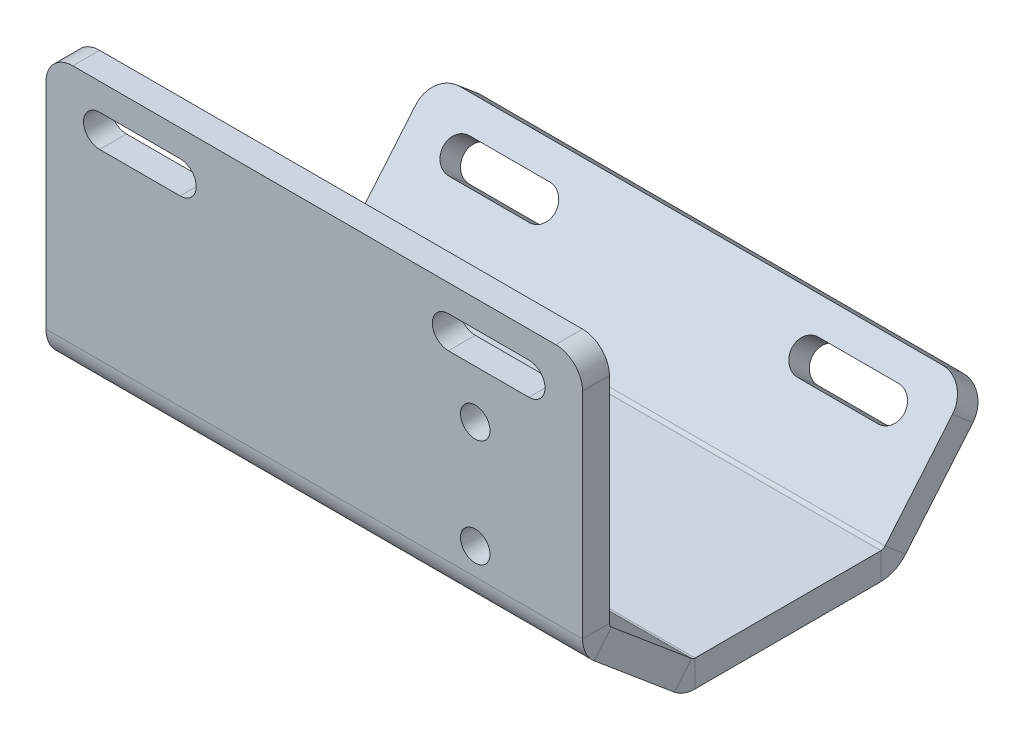
from build123d import *

# Parameters (mm, degrees)
SKETCH1_W                = 100
SKETCH1_H                = 45
BASE_FLANGE1_DEPTH       = 5
EDGE_FLANGE1_DEPTH       = 100
EDGE_FLANGE2_DEPTH       = 100
EDGE_FLANGE3_DEPTH       = 100
CUT_EXTRUDE1_REACH       = 135.401
SKETCH15_R               = 2.5
CUT_EXTRUDE2_DEPTH       = 10
M5_CLEARANCE_HOLE1_D     = 5.5
M5_CLEARANCE_HOLE1_DEPTH = 15.966
M5_CLEARANCE_HOLE1_TIP   = 1.652366702
BREAK_CORNER1_START      = -52.832474919
BREAK_CORNER1_DEPTH      = 5
BREAK_CORNER1_2_DEPTH    = 5


# Read off the part's stored shape, not the designer's step: Break-Corner1
# Sheet-metal steps are written as plain solids
with BuildPart() as part:
    # Sketch1 → Base-Flange1 (new body)
    with BuildSketch(Plane.XY):
        with Locations((50, 22.5)):
            Rectangle(SKETCH1_W, SKETCH1_H)
    extrude(amount=BASE_FLANGE1_DEPTH)

    # Edge-Flange1 section (across the edge) → Edge-Flange1 (add)
    with BuildSketch(Plane(origin=(100, -0.466307658, 0), x_dir=(0, 0.7660444431189746, -0.6427876096865435), z_dir=(-1, 0, 0))):
        with BuildLine():
            Line((-5, 0.466307658), (-5, 20))
            Line((-5, 20), (0, 20))
            Line((0, 20), (0, 0.466307658))
            ThreePointArc((0, 0.466307658), (0.093692213, 0.043689396), (0.35721239, -0.299736785))
            Line((0.35721239, -0.299736785), (-2.856725658, -4.129959001))
            ThreePointArc((-2.856725658, -4.129959001), (-4.437846722, -2.069401912), (-5, 0.466307658))
        make_face()
    extrude(amount=EDGE_FLANGE1_DEPTH)

    # Edge-Flange2 section (across the edge) → Edge-Flange2 (add)
    with BuildSketch(Plane(origin=(100, -13.556015409, -15.599706238), x_dir=(0, 1, 0), z_dir=(-1, 0, 0))):
        with BuildLine():
            Line((-5, 0.363970234), (-5, 35))
            Line((-5, 35), (0, 35))
            Line((0, 35), (0, 0.363970234))
            ThreePointArc((0, 0.363970234), (0.060307379, 0.021950091), (0.233955557, -0.278817375))
            Line((0.233955557, -0.278817375), (-3.596266659, -3.492755424))
            ThreePointArc((-3.596266659, -3.492755424), (-4.638155725, -1.688150626), (-5, 0.363970234))
        make_face()
    extrude(amount=EDGE_FLANGE2_DEPTH)

    # Edge-Flange3 section (across the edge) → Edge-Flange3 (add)
    with BuildSketch(Plane(origin=(100, -13.556015409, -51.066013896), x_dir=(0, 0.6427876096865516, 0.7660444431189678), z_dir=(-1, 0, 0))):
        with BuildLine():
            Line((-5, 0.466307658), (-5, 25))
            Line((-5, 25), (0, 25))
            Line((0, 25), (0, 0.466307658))
            ThreePointArc((0, 0.466307658), (0.093692213, 0.043689396), (0.35721239, -0.299736785))
            Line((0.35721239, -0.299736785), (-2.856725658, -4.129959001))
            ThreePointArc((-2.856725658, -4.129959001), (-4.437846722, -2.069401912), (-5, 0.466307658))
        make_face()
    extrude(amount=EDGE_FLANGE3_DEPTH)

    # Sketch15 → Cut-Extrude1 (cut, up to next)
    with BuildSketch(Plane.XY.offset(5), mode=Mode.PRIVATE) as cut_extrude1_sk1:
        with Locations((80, 5)):
            Circle(SKETCH15_R)
    cut_extrude1_tool1 = extrude(cut_extrude1_sk1.sketch, amount=-CUT_EXTRUDE1_REACH, mode=Mode.PRIVATE) & part.part
    # Sketch15 → Cut-Extrude1 (cut, up to next)
    with BuildSketch(Plane.XY.offset(5), mode=Mode.PRIVATE) as cut_extrude1_sk2:
        with Locations((80, 25)):
            Circle(SKETCH15_R)
    cut_extrude1_tool2 = extrude(cut_extrude1_sk2.sketch, amount=-CUT_EXTRUDE1_REACH, mode=Mode.PRIVATE) & part.part
    # Sketch15 → Cut-Extrude1 (cut, up to next)
    with BuildSketch(Plane.XY.offset(5), mode=Mode.PRIVATE) as cut_extrude1_sk3:
        with BuildLine():
            Line((10, 40), (25, 40))
            ThreePointArc((25, 40), (28, 37), (25, 34))
            Line((25, 34), (10, 34))
            ThreePointArc((10, 34), (7, 37), (10, 40))
        make_face()
    cut_extrude1_tool3 = extrude(cut_extrude1_sk3.sketch, amount=-CUT_EXTRUDE1_REACH, mode=Mode.PRIVATE) & part.part
    # Sketch15 → Cut-Extrude1 (cut, up to next)
    with BuildSketch(Plane.XY.offset(5), mode=Mode.PRIVATE) as cut_extrude1_sk4:
        with BuildLine():
            Line((75, 40), (90, 40))
            ThreePointArc((90, 40), (93, 37), (90, 34))
            Line((90, 34), (75, 34))
            ThreePointArc((75, 34), (72, 37), (75, 40))
        make_face()
    cut_extrude1_tool4 = extrude(cut_extrude1_sk4.sketch, amount=-CUT_EXTRUDE1_REACH, mode=Mode.PRIVATE) & part.part
    add(cut_extrude1_tool1.solids().sort_by_distance((80, 5, 5))[0], mode=Mode.SUBTRACT)
    add(cut_extrude1_tool2.solids().sort_by_distance((80, 25, 5))[0], mode=Mode.SUBTRACT)
    add(cut_extrude1_tool3.solids().sort_by_distance((17.5, 37, 5))[0], mode=Mode.SUBTRACT)
    add(cut_extrude1_tool4.solids().sort_by_distance((82.5, 37, 5))[0], mode=Mode.SUBTRACT)

    # Sketch16 → Cut-Extrude2 (cut)
    with BuildSketch(Plane(origin=(0, -30.746122218, -36.641801612), x_dir=(1, 0, 0), z_dir=(0, 0.6427876096865515, 0.7660444431189678))):
        with BuildLine():
            Line((10, 42.440090734), (25, 42.440090734))
            ThreePointArc((25, 42.440090734), (28, 39.440090734), (25, 36.440090734))
            Line((25, 36.440090734), (10, 36.440090734))
            ThreePointArc((10, 36.440090734), (7, 39.440090734), (10, 42.440090734))
        make_face()
        with BuildLine():
            Line((75, 42.440090734), (90, 42.440090734))
            ThreePointArc((90, 42.440090734), (93, 39.440090734), (90, 36.440090734))
            Line((90, 36.440090734), (75, 36.440090734))
            ThreePointArc((75, 36.440090734), (72, 39.440090734), (75, 42.440090734))
        make_face()
    extrude(amount=-CUT_EXTRUDE2_DEPTH, mode=Mode.SUBTRACT)

    # M5 Clearance Hole1
    with Locations(Plane.XY.offset(5)):
        with Locations((80, 25), (80, 5)):
            Hole(M5_CLEARANCE_HOLE1_D / 2, depth=M5_CLEARANCE_HOLE1_DEPTH)
            with Locations((0, 0, -(M5_CLEARANCE_HOLE1_DEPTH + M5_CLEARANCE_HOLE1_TIP / 2))):  # 118° drill point
                Cone(0, M5_CLEARANCE_HOLE1_D / 2, M5_CLEARANCE_HOLE1_TIP, mode=Mode.SUBTRACT)

    # Break-Corner1 outline → Break-Corner1 (cut)
    with BuildSketch(Plane(origin=(0, 0, 0), x_dir=(1, 0, 0), z_dir=(0, 0.6427876096865517, 0.7660444431189677)).offset(BREAK_CORNER1_START)):
        with BuildLine():
            ThreePointArc((0, 42.440090734), (1.464466094, 45.97562464), (5, 47.440090734))
            Line((5, 47.440090734), (0, 47.440090734))
            Line((0, 47.440090734), (0, 42.440090734))
        make_face()
        with BuildLine():
            ThreePointArc((95, 47.440090734), (98.535533906, 45.97562464), (100, 42.440090734))
            Line((100, 42.440090734), (100, 47.440090734))
            Line((100, 47.440090734), (95, 47.440090734))
        make_face()
    extrude(amount=BREAK_CORNER1_DEPTH, mode=Mode.SUBTRACT)

    # Break-Corner1 2 outline → Break-Corner1 2 (cut)
    with BuildSketch(Plane.XY):
        with BuildLine():
            Line((0, 45), (0, 40))
            ThreePointArc((0, 40), (1.464466094, 43.535533906), (5, 45))
            Line((5, 45), (0, 45))
        make_face()
        with BuildLine():
            Line((100, 45), (95, 45))
            ThreePointArc((95, 45), (98.535533906, 43.535533906), (100, 40))
            Line((100, 40), (100, 45))
        make_face()
    extrude(amount=BREAK_CORNER1_2_DEPTH, mode=Mode.SUBTRACT)


solid = part.part
